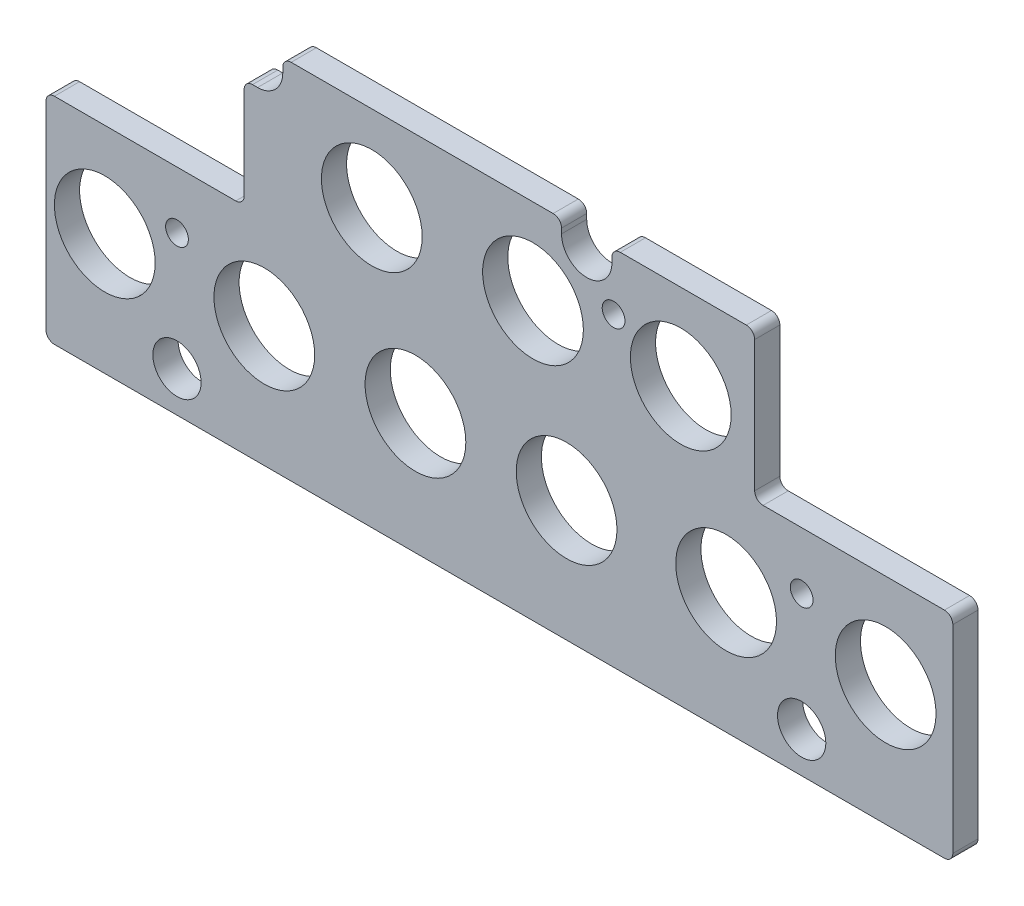
from build123d import *

# Parameters (mm, degrees)
BOSS_EXTRUDE1_DEPTH              = 4.7625
SKETCH3_R                        = 9.525
CUT_EXTRUDE1_DEPTH               = 95.204851924
F_6_CLEARANCE_HOLE1_D            = 4.3053
F_23_64_0_35938_DIAMETER_HOLE1_D = 9.128252
FILLET1_R                        = 1.5875


with BuildPart() as part:
    # Sketch1 → Boss-Extrude1 (new body)
    with BuildSketch(Plane.XY):
        with BuildLine():
            Line((-40.9575, 29.810203833), (-40.9575, 27.270203833))
            ThreePointArc((-40.9575, 27.270203833), (-42.352403955, 23.902607788), (-45.72, 22.507703833))
            Line((-45.72, 22.507703833), (-48.26, 22.507703833))
            Line((-48.26, 22.507703833), (-48.26, 1.870203833))
            Line((-48.26, 1.870203833), (-85.725, 1.870203833))
            Line((-85.725, 1.870203833), (-85.725, -38.769796167))
            Line((-85.725, -38.769796167), (85.725, -38.769796167))
            Line((85.725, -38.769796167), (85.725, 1.870203833))
            Line((85.725, 1.870203833), (48.26, 1.870203833))
            Line((48.26, 1.870203833), (48.26, 29.810203833))
            Line((48.26, 29.810203833), (21.2725, 29.810203833))
            Line((21.2725, 29.810203833), (21.2725, 27.270203833))
            ThreePointArc((21.2725, 27.270203833), (16.51, 22.507703833), (11.7475, 27.270203833))
            Line((11.7475, 27.270203833), (11.7475, 29.810203833))
            Line((11.7475, 29.810203833), (-40.9575, 29.810203833))
        make_face()
    extrude(amount=BOSS_EXTRUDE1_DEPTH)

    # Sketch3 → Cut-Extrude1 (cut, through all)
    with BuildSketch(Plane.XY.offset(4.7625)):
        with Locations((73.025, -15.909796167)):
            Circle(SKETCH3_R)
        with Locations((42.8625, -15.909796167)):
            Circle(SKETCH3_R)
        with Locations((12.7, -15.909796167)):
            Circle(SKETCH3_R)
        with Locations((-15.875, -15.909796167)):
            Circle(SKETCH3_R)
        with Locations((-44.45, -15.909796167)):
            Circle(SKETCH3_R)
        with Locations((-74.6125, -15.909796167)):
            Circle(SKETCH3_R)
        with Locations((34.29, 13.617703833)):
            Circle(SKETCH3_R)
        with Locations((6.35, 13.617703833)):
            Circle(SKETCH3_R)
        with Locations((-24.13, 13.617703833)):
            Circle(SKETCH3_R)
    extrude(amount=-CUT_EXTRUDE1_DEPTH, mode=Mode.SUBTRACT)

    # #6 Clearance Hole1 (through all)
    with Locations(Plane.XY.offset(4.7625)):
        with Locations((57.15, -8.924796167), (21.59, 19.015203833), (-60.96, -8.924796167)):
            Hole(F_6_CLEARANCE_HOLE1_D / 2)

    # 23/64 (0.35938) Diameter Hole1 (through all)
    with Locations(Plane.XY.offset(4.7625)):
        with Locations((57.15, -31.149796167), (-60.96, -31.149796167)):
            Hole(F_23_64_0_35938_DIAMETER_HOLE1_D / 2)

    # Fillet1
    fillet1_edges = [part.edges().sort_by_distance(p)[0] for p in [
        (85.725, -38.769796167, 2.38125),
        (-85.725, -38.769796167, 2.38125),
        (85.725, 1.870203833, 2.38125),
        (48.26, 1.870203833, 2.38125),
        (48.26, 29.810203833, 2.38125),
        (21.2725, 29.810203833, 2.38125),
        (11.7475, 29.810203833, 2.38125),
        (-40.9575, 29.810203833, 2.38125),
        (-48.26, 22.507703833, 2.38125),
        (-48.26, 1.870203833, 2.38125),
        (-85.725, 1.870203833, 2.38125),
    ]]
    fillet(fillet1_edges, radius=FILLET1_R)


solid = part.part
